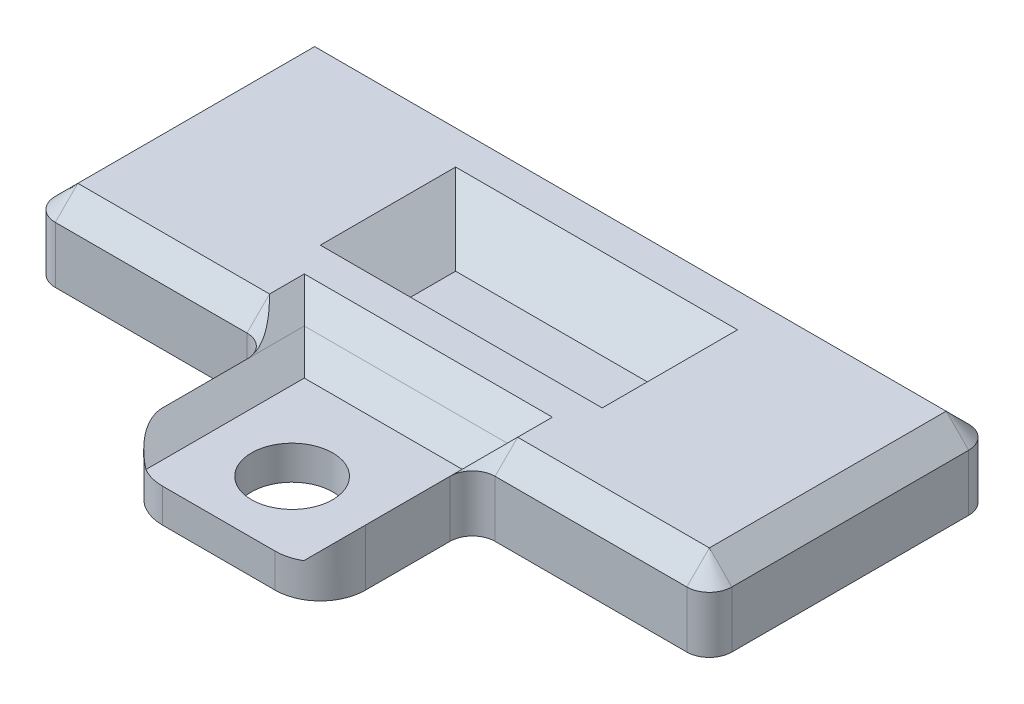
from build123d import *

# Parameters (mm, degrees)
BOSS_EXTRUDE1_DEPTH  = 3.5
SKETCH2_W            = 4
SKETCH2_H            = 10
CUT_EXTRUDE1_DEPTH   = 2.5
FILLET1_R            = 1
FILLET2_R            = 1
FILLET2_OF_MIRROR1_R = 1
SKETCH3_W            = 9
SKETCH3_H            = 8.290227197
CUT_EXTRUDE3_DEPTH   = 2
CHAMFER2_START       = 4.709772803
CHAMFER2_DEPTH       = 8.290227197
CHAMFER2_START_2     = 3
CHAMFER2_2_DEPTH     = 2.09807924
CHAMFER3_SIZE        = 1
M3_CLEARANCE_HOLE2_D = 3.6
FILLET4_R            = 2
SKETCH13_W           = 12.5
SKETCH13_H           = 6
CUT_EXTRUDE4_DEPTH   = 2
CHAMFER4_SIZE        = 2


with BuildPart() as part:
    # Sketch1 → Boss-Extrude1 (new body)
    with BuildSketch(Plane(origin=(0, 0, 0), x_dir=(1, 0, 0), z_dir=(0, 1, 0))):
        Polygon((-4.5, -6.25), (-15, -6.25), (-15, 6.25), (15, 6.25), (15, -6.25), (4.5, -6.25), (4.5, -13), (-4.5, -13), align=None)
    extrude(amount=BOSS_EXTRUDE1_DEPTH)

    # Sketch2 → Cut-Extrude1 (cut)
    with BuildSketch(Plane.XZ):
        with Locations((-11, 0)):
            Rectangle(SKETCH2_W, SKETCH2_H)
    cut_extrude1 = extrude(amount=-CUT_EXTRUDE1_DEPTH, mode=Mode.SUBTRACT)

    # Fillet1
    fillet1_edges = [part.edges().sort_by_distance(p)[0] for p in [
        (-15, 1.75, -6.25),
        (15, 1.75, -6.25),
        (15, 1.75, 6.25),
        (4.5, 1.75, 6.25),
        (-4.5, 1.75, 6.25),
        (-15, 1.75, 6.25),
    ]]
    fillet(fillet1_edges, radius=FILLET1_R)

    # Fillet2
    fillet2_edges = [part.edges().sort_by_distance(p)[0] for p in [
        (-9, 1.25, 5),
        (-9, 1.25, -5),
        (-13, 1.25, -5),
        (-13, 1.25, 5),
    ]]
    fillet(fillet2_edges, radius=FILLET2_R)

    # Mirror1: Cut-Extrude1 across plane
    add(cut_extrude1.mirror(Plane(origin=(0, 0, 0), x_dir=(0, 0, 1), z_dir=(1, 0, 0))), mode=Mode.SUBTRACT)

    # Fillet2 of Mirror1
    fillet2_of_mirror1_edges = [part.edges().sort_by_distance(p)[0] for p in [
        (9, 1.25, 5),
        (9, 1.25, -5),
        (13, 1.25, -5),
        (13, 1.25, 5),
    ]]
    fillet(fillet2_of_mirror1_edges, radius=FILLET2_OF_MIRROR1_R)

    # Sketch3 → Cut-Extrude3 (cut)
    with BuildSketch(Plane(origin=(0, 3.5, 0), x_dir=(1, 0, 0), z_dir=(0, 1, 0))):
        with Locations((0, -8.854886401)):
            Rectangle(SKETCH3_W, SKETCH3_H)
    extrude(amount=-CUT_EXTRUDE3_DEPTH, mode=Mode.SUBTRACT)

    # Chamfer2: read off the stored shape, not the designer's step
    # Chamfer2 outline → Chamfer2 (add)
    with BuildSketch(Plane.XY.offset(CHAMFER2_START)):
        Polygon((4.5, 2.5), (3.5, 1.5), (4.5, 1.5), align=None)
        Polygon((-4.5, 2.5), (-4.5, 1.5), (-3.5, 1.5), align=None)
    extrude(amount=CHAMFER2_DEPTH)

    # Chamfer2 2 outline → Chamfer2 2 (add)
    with BuildSketch(Plane(origin=(0, 0, 0), x_dir=(1, 0, 0), z_dir=(0, 0.70710678118655, 0.707106781186545)).offset(CHAMFER2_START_2)):
        Polygon((4.5, -1.562545334), (-4.5, -1.562545334), (-3.5, -2.976758896), (3.5, -2.976758896), align=None)
    extrude(amount=CHAMFER2_2_DEPTH)

    # Chamfer3
    chamfer3_edges = [part.edges().sort_by_distance(p)[0] for p in [
        (-4.792893219, 3.5, 6.542893219),
        (-9.75, 3.5, 6.25),
        (-14.707106781, 3.5, 5.957106781),
        (-15, 3.5, 0),
        (-14.707106781, 3.5, -5.957106781),
        (0, 3.5, -6.25),
        (14.707106781, 3.5, -5.957106781),
        (15, 3.5, 0),
        (14.707106781, 3.5, 5.957106781),
        (9.75, 3.5, 6.25),
        (4.792893219, 3.5, 6.542893219),
        (4.5, 3.5, 5.979886401),
        (0, 3.5, 4.709772803),
        (-4.5, 3.5, 5.979886401),
    ]]
    chamfer(chamfer3_edges, length=CHAMFER3_SIZE - 0.0001)  # a hair under: the kernel refuses the full size

    # M3 Clearance Hole2 (through all)
    with Locations(Plane(origin=(0, 1.5, 0), x_dir=(1, 0, 0), z_dir=(0, 1, 0))):
        with Locations((0, -9.75)):
            Hole(M3_CLEARANCE_HOLE2_D / 2)

    # Fillet4
    fillet4_edges = [part.edges().sort_by_distance(p)[0] for p in [
        (4.5, 1.25, 13),
        (-4.5, 1.25, 13),
    ]]
    fillet(fillet4_edges, radius=FILLET4_R)

    # Sketch13 → Cut-Extrude4 (cut)
    with BuildSketch(Plane(origin=(0, 3.5, 0), x_dir=(1, 0, 0), z_dir=(0, 1, 0))):
        with Locations((0, 0.75)):
            Rectangle(SKETCH13_W, SKETCH13_H)
    extrude(amount=-CUT_EXTRUDE4_DEPTH, mode=Mode.SUBTRACT)

    # Chamfer4
    chamfer4_edges = [part.edges().sort_by_distance(p)[0] for p in [
        (0, 1.5, -3.75),
        (6.25, 1.5, -0.75),
        (0, 1.5, 2.25),
        (-6.25, 1.5, -0.75),
    ]]
    chamfer(chamfer4_edges, length=CHAMFER4_SIZE - 0.0001)  # a hair under: the kernel refuses the full size


solid = part.part
